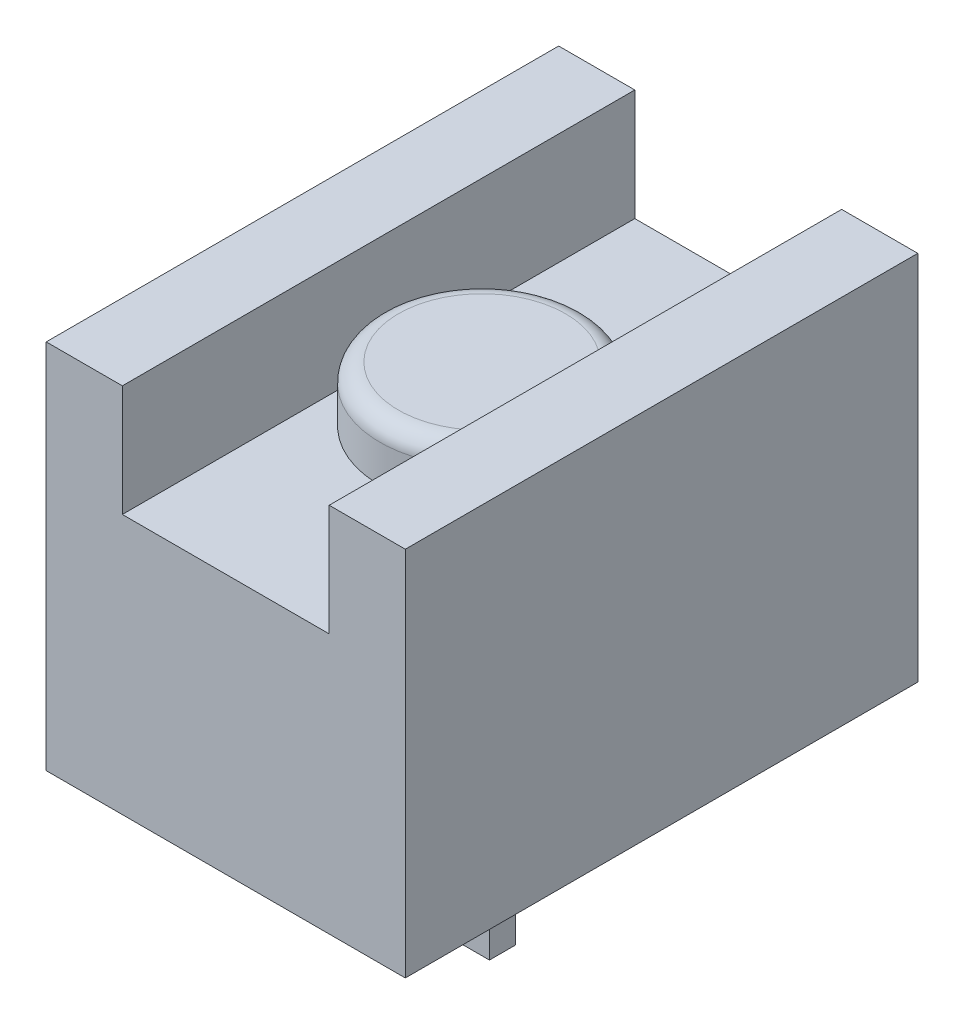
from build123d import *

# Parameters (mm, degrees)
SKETCH_1_W          = 9.67
SKETCH_1_H          = 13.8
EXTRUDE_1_DEPTH     = 10
SKETCH_2_W          = 5.57
SKETCH_2_H          = 13.8
CUT_EXTRUDE_1_DEPTH = 3
SKETCH_3_W          = 1.1
SKETCH_3_H          = 0.7
EXTRUDE_2_DEPTH     = 5
SKETCH_4_R          = 2.75
EXTRUDE_1_2_DEPTH   = 1.5
FILLET_1_R          = 0.5


with BuildPart() as part:
    # 草图1 → Extrude 1 (new body)
    with BuildSketch(Plane(origin=(0, 0, 0), x_dir=(1, 0, 0), z_dir=(0, 1, 0))):
        Rectangle(SKETCH_1_W, SKETCH_1_H)
    extrude(amount=EXTRUDE_1_DEPTH)

    # 草图2 → 切除-拉伸1 (cut)
    with BuildSketch(Plane(origin=(0, 10, 0), x_dir=(-1, 0, 0), z_dir=(0, 1, 0))):
        Rectangle(SKETCH_2_W, SKETCH_2_H)
    extrude(amount=-CUT_EXTRUDE_1_DEPTH, mode=Mode.SUBTRACT)

    # 草图3 → 拉伸2 (add)
    with BuildSketch(Plane.XZ):
        Rectangle(SKETCH_3_W, SKETCH_3_H)
    extrude(amount=EXTRUDE_2_DEPTH)

    # 草图4 → Extrude 1 2 (add)
    with BuildSketch(Plane(origin=(0, 7, 0), x_dir=(-1, 0, 0), z_dir=(0, 1, 0))):
        Circle(SKETCH_4_R)
    extrude(amount=EXTRUDE_1_2_DEPTH)

    # 圆角1
    fillet_1_edges = [part.edges().sort_by_distance(p)[0] for p in [
        (2.75, 8.5, 0),
    ]]
    fillet(fillet_1_edges, radius=FILLET_1_R)


solid = part.part
